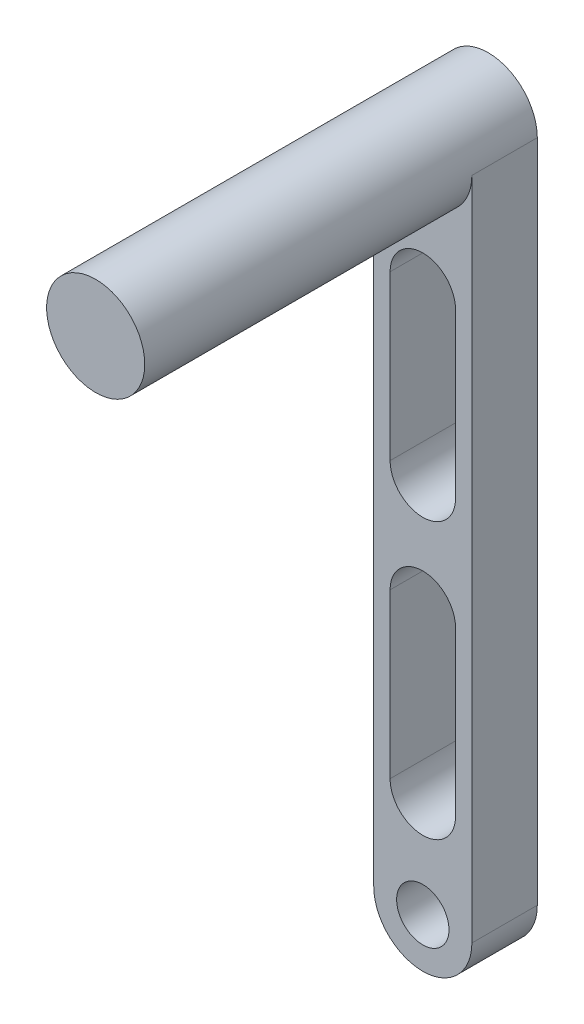
from build123d import *

# Parameters (mm, degrees)
SKETCH1_R           = 4
BOSS_EXTRUDE1_DEPTH = 10
BOSS_EXTRUDE2_DEPTH = 60


with BuildPart() as part:
    # Sketch1 → Boss-Extrude1 (new body)
    with BuildSketch(Plane.XY):
        with BuildLine():
            Line((-7.5, 50.8), (-7.5, -50.8))
            ThreePointArc((-7.5, -50.8), (0, -58.3), (7.5, -50.8))
            Line((7.5, -50.8), (7.5, 50.8))
            ThreePointArc((7.5, 50.8), (0, 43.3), (-7.5, 50.8))
        make_face()
        with Locations((0, -50.8)):
            Circle(SKETCH1_R, mode=Mode.SUBTRACT)
        with BuildLine():
            ThreePointArc((5, -35.3), (0, -40.3), (-5, -35.3))
            Line((-5, -35.3), (-5, -10.3))
            ThreePointArc((-5, -10.3), (0, -5.3), (5, -10.3))
            Line((5, -10.3), (5, -35.3))
        make_face(mode=Mode.SUBTRACT)
        with BuildLine():
            ThreePointArc((-5, 31.8), (0, 36.8), (5, 31.8))
            Line((5, 31.8), (5, 6.8))
            ThreePointArc((5, 6.8), (0, 1.8), (-5, 6.8))
            Line((-5, 6.8), (-5, 31.8))
        make_face(mode=Mode.SUBTRACT)
    extrude(amount=BOSS_EXTRUDE1_DEPTH)

    # Sketch1<4> → Boss-Extrude2 (add)
    with BuildSketch(Plane.XY):
        with BuildLine():
            ThreePointArc((7.5, 50.8), (0, 58.3), (-7.5, 50.8))
            ThreePointArc((-7.5, 50.8), (0, 43.3), (7.5, 50.8))
        make_face()
    extrude(amount=BOSS_EXTRUDE2_DEPTH)


solid = part.part
